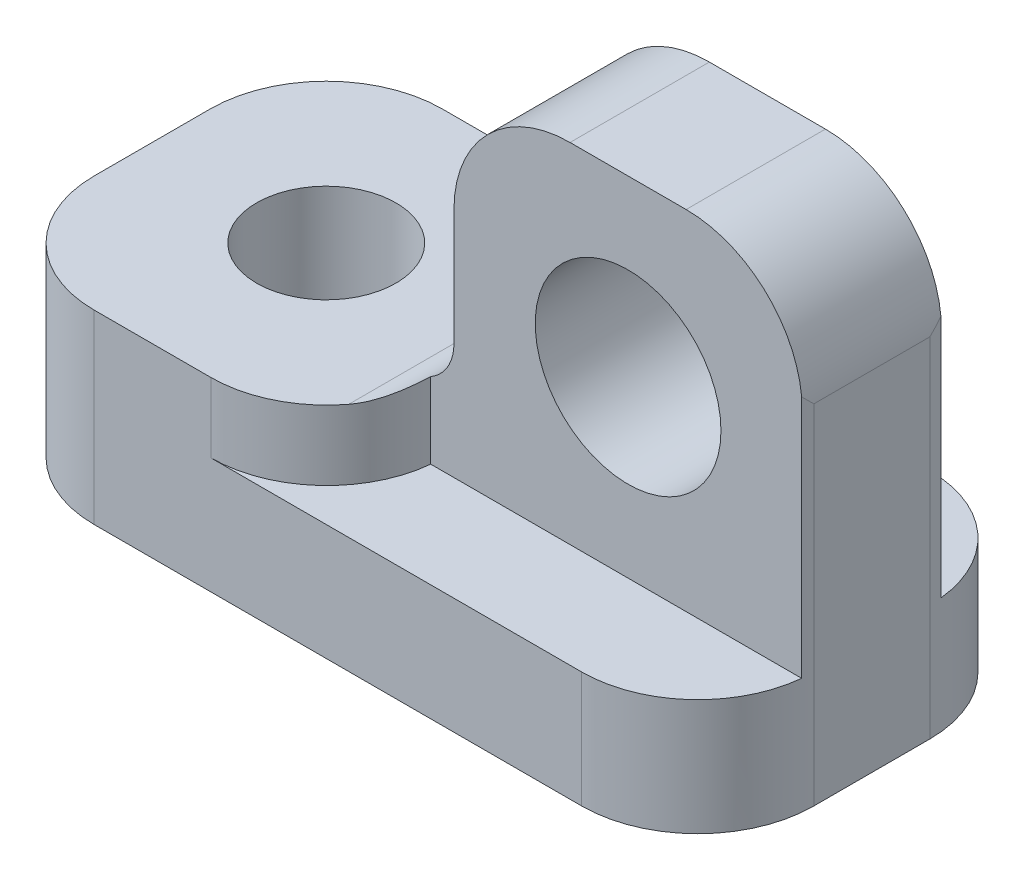
from build123d import *

# Parameters (mm, degrees)
SKETCH1_W           = 31
SKETCH1_H           = 15
BOSS_EXTRUDE1_DEPTH = 5
SKETCH2_W           = 15
SKETCH2_H           = 15
BOSS_EXTRUDE2_DEPTH = 3
SKETCH3_W           = 15
SKETCH3_H           = 6
BOSS_EXTRUDE3_DEPTH = 15
SKETCH4_W           = 1
SKETCH4_H           = 6
RIB_DEPTH           = 3
SKETCH5_R           = 4
CUT_EXTRUDE1_DEPTH  = 39.356876828
SKETCH6_R           = 3
CUT_EXTRUDE2_DEPTH  = 7.8
FILLET1_R           = 5
FILLET2_R           = 5
FILLET3_R           = 2


with BuildPart() as part:
    # Sketch1 → Boss-Extrude1 (new body)
    with BuildSketch(Plane(origin=(0, 0, 0), x_dir=(1, 0, 0), z_dir=(0, 1, 0))):
        with Locations((15.5, 7.5)):
            Rectangle(SKETCH1_W, SKETCH1_H)
    extrude(amount=BOSS_EXTRUDE1_DEPTH)

    # Sketch2 → Boss-Extrude2 (add)
    with BuildSketch(Plane(origin=(0, 5, 0), x_dir=(1, 0, 0), z_dir=(0, 1, 0))):
        with Locations((7.5, 7.5)):
            Rectangle(SKETCH2_W, SKETCH2_H)
    extrude(amount=BOSS_EXTRUDE2_DEPTH)

    # Sketch3 → Boss-Extrude3 (add)
    with BuildSketch(Plane(origin=(0, 5, 0), x_dir=(1, 0, 0), z_dir=(0, 1, 0))):
        with Locations((23.5, 7.5)):
            Rectangle(SKETCH3_W, SKETCH3_H)
    extrude(amount=BOSS_EXTRUDE3_DEPTH)

    # Sketch4 → rib (add)
    with BuildSketch(Plane(origin=(0, 5, 0), x_dir=(1, 0, 0), z_dir=(0, 1, 0))):
        with Locations((15.5, 7.5)):
            Rectangle(SKETCH4_W, SKETCH4_H)
    extrude(amount=RIB_DEPTH)

    # Sketch5 → Cut-Extrude1 (cut, through all)
    with BuildSketch(Plane.XY.offset(-4.5)):
        with Locations((23.5, 12.5)):
            Circle(SKETCH5_R)
    extrude(amount=-CUT_EXTRUDE1_DEPTH, mode=Mode.SUBTRACT)

    # Sketch6 → Cut-Extrude2 (cut)
    with BuildSketch(Plane(origin=(0, 8, 0), x_dir=(1, 0, 0), z_dir=(0, 1, 0))):
        with Locations(Location((7.5, 7.5, 0), (0, 0, 270))):
            Circle(SKETCH6_R)
    extrude(amount=-CUT_EXTRUDE2_DEPTH, mode=Mode.SUBTRACT)

    # Fillet1
    fillet1_edges = [part.edges().sort_by_distance(p)[0] for p in [
        (16, 20, -7.5),
        (31, 20, -7.5),
    ]]
    fillet(fillet1_edges, radius=FILLET1_R)

    # Fillet2
    # the kernel refuses this fillet: 5 mm, written as the material it takes off along each edge
    with BuildSketch(Plane(origin=(31, -12.5, -15), x_dir=(0, 0, 1), z_dir=(0, 1, 0))) as fillet2_piece_1:
        with BuildLine():
            CenterArc((FILLET2_R, -FILLET2_R), FILLET2_R, 90, 90)
            Line((0, -FILLET2_R), (0, 0))
            Line((0, 0), (FILLET2_R, 0))
        make_face()
    extrude(amount=30, mode=Mode.SUBTRACT)
    with BuildSketch(Plane(origin=(31, -12.5, 0), x_dir=(0, 0, -1), z_dir=(0, 1, 0))) as fillet2_piece_2:
        with BuildLine():
            CenterArc((FILLET2_R, FILLET2_R), FILLET2_R, 180, 90)
            Line((0, FILLET2_R), (0, 0))
            Line((0, 0), (FILLET2_R, 0))
        make_face()
    extrude(amount=30, mode=Mode.SUBTRACT)
    with BuildSketch(Plane(origin=(15, 5, -15), x_dir=(-1, 0, 0), z_dir=(0, 1, 0))) as fillet2_piece_3:
        with BuildLine():
            CenterArc((4.974937186, 5), FILLET2_R, 185.739170477, 84.260829523)
            Line((0, 4.5), (0, 0))
            Line((0, 0), (4.974937186, 0))
        make_face()
    extrude(amount=15.437342964, mode=Mode.SUBTRACT)
    with BuildSketch(Plane(origin=(15, 5, 0), x_dir=(-1, 0, 0), z_dir=(0, 1, 0))) as fillet2_piece_4:
        with BuildLine():
            CenterArc((4.974937186, -5), FILLET2_R, 90, 84.260829523)
            Line((0, -4.5), (0, 0))
            Line((0, 0), (4.974937186, 0))
        make_face()
    extrude(amount=15.437342964, mode=Mode.SUBTRACT)
    with BuildSketch(Plane(origin=(0, 20.5, 0), x_dir=(1, 0, 0), z_dir=(0, -1, 0))) as fillet2_piece_5:
        with BuildLine():
            CenterArc((FILLET2_R, -FILLET2_R), FILLET2_R, 90, 90)
            Line((0, -FILLET2_R), (0, 0))
            Line((0, 0), (FILLET2_R, 0))
        make_face()
    extrude(amount=33, mode=Mode.SUBTRACT)
    with BuildSketch(Plane(origin=(0, 20.5, -15), x_dir=(1, 0, 0), z_dir=(0, -1, 0))) as fillet2_piece_6:
        with BuildLine():
            CenterArc((FILLET2_R, FILLET2_R), FILLET2_R, 180, 90)
            Line((0, FILLET2_R), (0, 0))
            Line((0, 0), (FILLET2_R, 0))
        make_face()
    extrude(amount=33, mode=Mode.SUBTRACT)

    # Fillet3
    fillet3_edges = [part.edges().sort_by_distance(p)[0] for p in [
        (16, 8, -7.5),
    ]]
    fillet(fillet3_edges, radius=FILLET3_R)


solid = part.part
